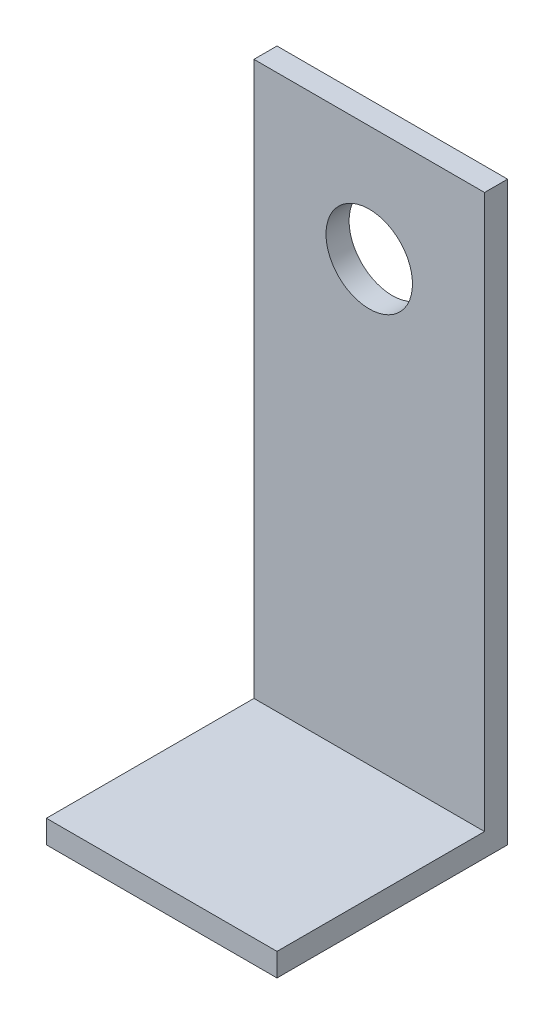
from build123d import *

# Parameters (mm, degrees)
BOSS_EXTRUDE1_DEPTH      = 12.7
BOSS_EXTRUDE1_DEPTH_BACK = 12.7
SKETCH2_R                = 4.7625
CUT_EXTRUDE1_DEPTH       = 12.7


with BuildPart() as part:
    # Sketch1 → Boss-Extrude1 (new, two sides: drawn at the far end of the back side and taken through both)
    with BuildSketch(Plane(origin=(0, 0, 0), x_dir=(0, 0, -1), z_dir=(1, 0, 0)).offset(-BOSS_EXTRUDE1_DEPTH_BACK)):
        Polygon((-25.4, 0), (0, 0), (0, 63.5), (-2.54, 63.5), (-2.54, 2.54), (-25.4, 2.54), align=None)
    extrude(amount=BOSS_EXTRUDE1_DEPTH + BOSS_EXTRUDE1_DEPTH_BACK)

    # Sketch2 → Cut-Extrude1 (cut)
    with BuildSketch(Plane.XY.offset(2.54)):
        with Locations((0, 50.8)):
            Circle(SKETCH2_R)
    extrude(amount=-CUT_EXTRUDE1_DEPTH, mode=Mode.SUBTRACT)


solid = part.part
